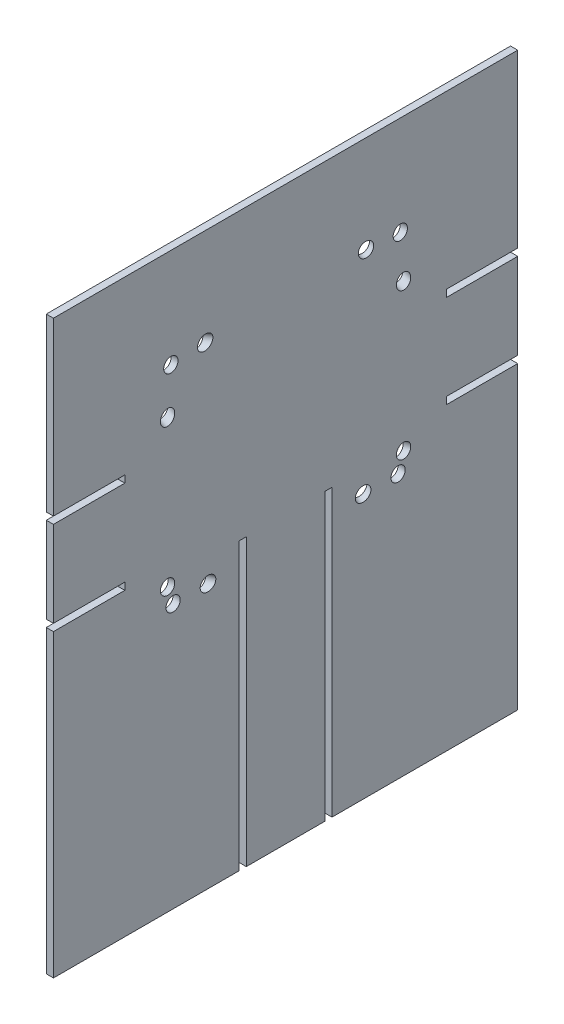
from build123d import *

# Parameters (mm, degrees)
SKETCH1_W               = 825.5
SKETCH1_H               = 1016
BOSS_EXTRUDE1_DEPTH     = 6.35
CAVITY1_START           = -69.750581005
CAVITY1_OUTLINE_R       = 12.7
CAVITY1_DEPTH           = 25.186721765
CAVITY1_2_OUTLINE_R     = 12.7
CAVITY1_2_DEPTH         = 25.186721765
CAVITY1_START_2         = 64.130873345
CAVITY1_3_OUTLINE_R     = 12.7
CAVITY1_3_DEPTH         = 25.120529807
CAVITY1_4_OUTLINE_R     = 12.7
CAVITY1_4_DEPTH         = 25.120529807
CAVITY1_START_3         = -292.036063147
CAVITY1_5_OUTLINE_R     = 12.7
CAVITY1_5_DEPTH         = 24.516904948
CAVITY1_6_OUTLINE_R     = 12.7
CAVITY1_6_DEPTH         = 24.516904948
CAVITY1_START_4         = 116.389417883
CAVITY1_7_OUTLINE_R     = 12.7
CAVITY1_7_DEPTH         = 16.544031778
CAVITY1_8_OUTLINE_R     = 12.7
CAVITY1_8_DEPTH         = 16.544031778
CAVITY1_START_5         = 111.910581246
CAVITY1_9_OUTLINE_R     = 12.7
CAVITY1_9_DEPTH         = 18.901264253
CAVITY1_START_6         = -6.35
CAVITY1_10_OUTLINE_R    = 12.7
CAVITY1_10_DEPTH        = 12.7
CAVITY1_11_OUTLINE_R    = 12.7
CAVITY1_11_DEPTH        = 18.901264253
CUT_EXTRUDE4_DEPTH      = 1097.658052904
CUT_EXTRUDE4_DEPTH_BACK = 1097.658052904
SKETCH5_W               = 12.7
SKETCH5_H               = 508
CUT_EXTRUDE5_DEPTH      = 1097.658052904
CUT_EXTRUDE5_DEPTH_BACK = 1097.658052904
SKETCH6_W               = 12.7
SKETCH6_H               = 508
SKETCH7_W               = 127
SKETCH7_H               = 12.7
CUT_EXTRUDE6_DEPTH      = 1097.658052904
SKETCH8_W               = 127
SKETCH8_H               = 12.7
CUT_EXTRUDE7_DEPTH      = 1097.658052904


# Read off the part's stored shape, not the designer's step: Cavity1
with BuildPart() as part:
    # Sketch1 → Boss-Extrude1 (new, symmetric)
    with BuildSketch(Plane(origin=(0, 0, 0), x_dir=(0, 0, -1), z_dir=(1, 0, 0))):
        with Locations((0, 508)):
            Rectangle(SKETCH1_W, SKETCH1_H)
    extrude(amount=BOSS_EXTRUDE1_DEPTH, both=True)

    # Cavity1 outline → Cavity1 (cut)
    with BuildSketch(Plane(origin=(0, 0, 0), x_dir=(0, 1, 0), z_dir=(0.9138115486202553, 0, 0.4061384660534521)).offset(CAVITY1_START)):
        with Locations((469.9, -128.603745276)):
            Circle(CAVITY1_OUTLINE_R)
    extrude(amount=CAVITY1_DEPTH, mode=Mode.SUBTRACT)

    # Cavity1 2 outline → Cavity1 2 (cut)
    with BuildSketch(Plane(origin=(0, 0, 0), x_dir=(0, 1, 0), z_dir=(0.913811548620257, 0, -0.406138466053448)).offset(CAVITY1_START)):
        with Locations((469.9, 128.603745276)):
            Circle(CAVITY1_2_OUTLINE_R)
    extrude(amount=CAVITY1_2_DEPTH, mode=Mode.SUBTRACT)

    # Cavity1 3 outline → Cavity1 3 (cut)
    with BuildSketch(Plane(origin=(0, 0, 0), x_dir=(-0.14398491314217557, 0.9878322579058099, -0.05878584037121407), z_dir=(0.9145455226247352, 0.15552308587701602, 0.37338861365384507)).offset(CAVITY1_START_2)):
        with Locations((840.881224499, -134.757426505)):
            Circle(CAVITY1_3_OUTLINE_R)
    extrude(amount=CAVITY1_3_DEPTH, mode=Mode.SUBTRACT)

    # Cavity1 4 outline → Cavity1 4 (cut)
    with BuildSketch(Plane(origin=(0, 0, 0), x_dir=(-0.14398491314217668, 0.9878322579058096, 0.05878584037121399), z_dir=(0.9145455226247362, 0.15552308587701702, -0.37338861365384207)).offset(CAVITY1_START_2)):
        with Locations((840.881224499, 134.757426505)):
            Circle(CAVITY1_4_OUTLINE_R)
    extrude(amount=CAVITY1_4_DEPTH, mode=Mode.SUBTRACT)

    # Cavity1 5 outline → Cavity1 5 (cut)
    with BuildSketch(Plane(origin=(0, 0, 0), x_dir=(0.3827993278239342, 0.9234408320803411, 0.026864554050110373), z_dir=(0.9211751685610859, -0.38374083656390695, 0.0646473447226402)).offset(CAVITY1_START_3)):
        with Locations((711.455758667, 208.844736372)):
            Circle(CAVITY1_5_OUTLINE_R)
    extrude(amount=CAVITY1_5_DEPTH, mode=Mode.SUBTRACT)

    # Cavity1 6 outline → Cavity1 6 (cut)
    with BuildSketch(Plane(origin=(0, 0, 0), x_dir=(0.3827993278239134, 0.9234408320803503, -0.02686455405009277), z_dir=(0.9211751685610978, -0.3837408365638849, -0.06464734472260218)).offset(CAVITY1_START_3)):
        with Locations((711.455758667, -208.844736372)):
            Circle(CAVITY1_6_OUTLINE_R)
    extrude(amount=CAVITY1_6_DEPTH, mode=Mode.SUBTRACT)

    # Cavity1 7 outline → Cavity1 7 (cut)
    with BuildSketch(Plane(origin=(0, 0, 0), x_dir=(-0.14162907065889588, 0.989911458049715, -0.00406344265182396), z_dir=(0.9895042824022925, 0.14168735025360304, 0.028389608761606212)).offset(CAVITY1_START_4)):
        with Locations((829.701952497, 203.742071242)):
            Circle(CAVITY1_7_OUTLINE_R)
    extrude(amount=CAVITY1_7_DEPTH, mode=Mode.SUBTRACT)

    # Cavity1 8 outline → Cavity1 8 (cut)
    with BuildSketch(Plane(origin=(0, 0, 0), x_dir=(-0.1416290706588989, 0.9899114580497147, 0.00406344265182273), z_dir=(0.9895042824022923, 0.14168735025360601, -0.028389608761597008)).offset(CAVITY1_START_4)):
        with Locations((829.701952497, -203.742071242)):
            Circle(CAVITY1_8_OUTLINE_R)
    extrude(amount=CAVITY1_8_DEPTH, mode=Mode.SUBTRACT)

    # Cavity1 9 outline → Cavity1 9 (cut)
    with BuildSketch(Plane(origin=(0, 0, 0), x_dir=(-0.2138887427613121, 0.9767426935099688, 0.015010542790871387), z_dir=(0.9743462537907107, 0.21441480983106392, -0.06837884942814358)).offset(CAVITY1_START_5)):
        with Locations((484.491346969, -208.844736372)):
            Circle(CAVITY1_9_OUTLINE_R)
    extrude(amount=CAVITY1_9_DEPTH, mode=Mode.SUBTRACT)

    # Cavity1 10 outline → Cavity1 10 (cut)
    with BuildSketch(Plane.YZ.offset(CAVITY1_START_6)):
        with Locations((469.9, -200)):
            Circle(CAVITY1_10_OUTLINE_R)
        with Locations((469.9, 200)):
            Circle(CAVITY1_10_OUTLINE_R)
    extrude(amount=CAVITY1_10_DEPTH, mode=Mode.SUBTRACT)

    # Cavity1 11 outline → Cavity1 11 (cut)
    with BuildSketch(Plane(origin=(0, 0, 0), x_dir=(-0.21388874276128378, 0.9767426935099748, -0.015010542790877034), z_dir=(0.9743462537907144, 0.21441480983103609, 0.06837884942817862)).offset(CAVITY1_START_5)):
        with Locations((484.491346969, 208.844736372)):
            Circle(CAVITY1_11_OUTLINE_R)
    extrude(amount=CAVITY1_11_DEPTH, mode=Mode.SUBTRACT)

    # Sketch5 → Cut-Extrude4 (cut, two sides: drawn at the far end of the back side and taken through both)
    with BuildSketch(Plane(origin=(0, 0, 0), x_dir=(0, 0, -1), z_dir=(1, 0, 0)).offset(-CUT_EXTRUDE4_DEPTH_BACK)):
        with Locations((76.2, 254)):
            Rectangle(SKETCH5_W, SKETCH5_H)
    extrude(amount=CUT_EXTRUDE4_DEPTH + CUT_EXTRUDE4_DEPTH_BACK, mode=Mode.SUBTRACT)

    # Sketch6 → Cut-Extrude5 (cut, two sides: drawn at the far end of the back side and taken through both)
    with BuildSketch(Plane(origin=(0, 0, 0), x_dir=(0, 0, -1), z_dir=(1, 0, 0)).offset(-CUT_EXTRUDE5_DEPTH_BACK)):
        with Locations((-76.2, 254)):
            Rectangle(SKETCH6_W, SKETCH6_H)
    extrude(amount=CUT_EXTRUDE5_DEPTH + CUT_EXTRUDE5_DEPTH_BACK, mode=Mode.SUBTRACT)

    # Sketch7 → Cut-Extrude6 (cut, symmetric)
    with BuildSketch(Plane(origin=(0, 0, 0), x_dir=(0, 0, -1), z_dir=(1, 0, 0))):
        with Locations((349.25, 704.85)):
            Rectangle(SKETCH7_W, SKETCH7_H)
    cut_extrude6 = extrude(amount=CUT_EXTRUDE6_DEPTH, both=True, mode=Mode.SUBTRACT)

    # Sketch8 → Cut-Extrude7 (cut, symmetric)
    with BuildSketch(Plane(origin=(0, 0, 0), x_dir=(0, 0, -1), z_dir=(1, 0, 0))):
        with Locations((-349.25, 539.75)):
            Rectangle(SKETCH8_W, SKETCH8_H)
    cut_extrude7 = extrude(amount=CUT_EXTRUDE7_DEPTH, both=True, mode=Mode.SUBTRACT)

    # Mirror1: Cut-Extrude6, Cut-Extrude7 across plane
    add(cut_extrude6.mirror(Plane.XY), mode=Mode.SUBTRACT)
    add(cut_extrude7.mirror(Plane.XY), mode=Mode.SUBTRACT)


solid = part.part
